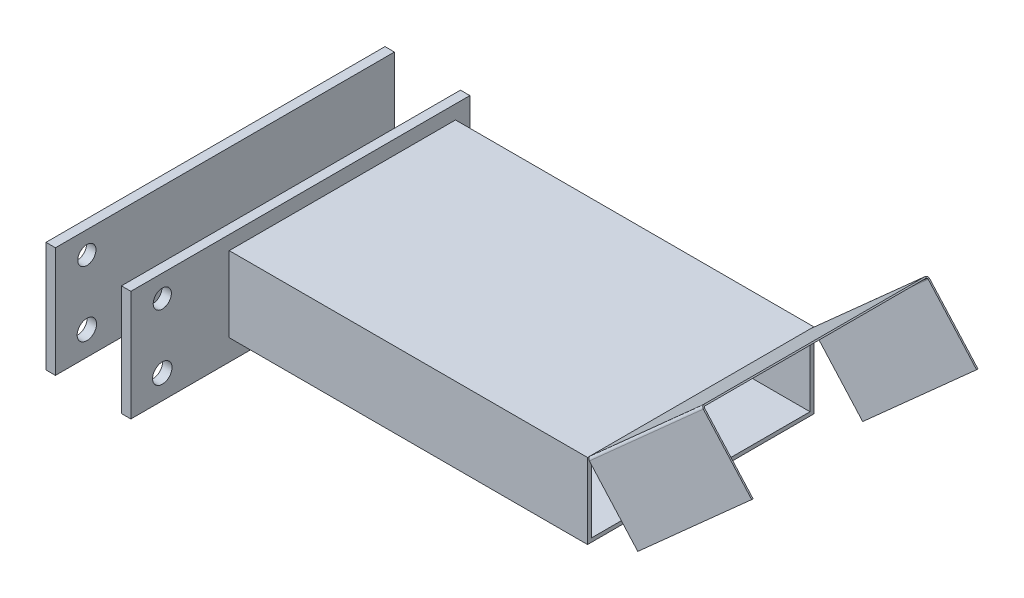
from build123d import *

# Parameters (mm, degrees)
SKETCH1_W                    = 120
SKETCH1_H                    = 40
SKETCH1_W_2                  = 116
SKETCH1_H_2                  = 36
BOSS_EXTRUDE1_DEPTH          = 190
SKETCH2_W                    = 179.779443165
SKETCH2_H                    = 58.646912064
SKETCH2_R                    = 4.82149765
SKETCH2_R_2                  = 5.140640696
BOSS_EXTRUDE2_DEPTH          = 5
BOSS_EXTRUDE3_START          = 40
SKETCH2_2_W                  = 179.779443165
SKETCH2_2_H                  = 58.646912064
SKETCH2_2_R                  = 4.82149765
SKETCH2_2_R_2                = 5.140640696
BOSS_EXTRUDE3_DEPTH          = 5
BASE_FLANGE1_DEPTH           = 120
EDGE_FLANGE1_STRIP_W         = 4.4196
EDGE_FLANGE1_STRIP_H         = 0.7366
EDGE_FLANGE1_STRIP_CUT_DEPTH = 81.034210559
EDGE_FLANGE1_DEPTH           = 81.034210559
EDGE_FLANGE2_STRIP_W         = 4.4196
EDGE_FLANGE2_STRIP_H         = 0.7366
EDGE_FLANGE2_STRIP_CUT_DEPTH = 81.034210559
EDGE_FLANGE2_DEPTH           = 81.034210559


# Sheet-metal steps are written as plain solids
with BuildPart() as part:
    # Sketch1 → Boss-Extrude1 (new body)
    with BuildSketch(Plane(origin=(0, 0, 0), x_dir=(0, 0, -1), z_dir=(1, 0, 0))):
        with Locations((60, -20)):
            Rectangle(SKETCH1_W, SKETCH1_H)
        with Locations((60, -20)):
            Rectangle(SKETCH1_W_2, SKETCH1_H_2, mode=Mode.SUBTRACT)
    extrude(amount=BOSS_EXTRUDE1_DEPTH)

    # Sketch2 → Boss-Extrude2 (add)
    with BuildSketch(Plane.ZY):
        with Locations((-37.714173415, -21.919353486)):
            Rectangle(SKETCH2_W, SKETCH2_H)
        with Locations((35.504640434, -4.261786117)):
            Circle(SKETCH2_R, mode=Mode.SUBTRACT)
        with Locations((35.504640434, -38.467545112)):
            Circle(SKETCH2_R_2, mode=Mode.SUBTRACT)
    extrude(amount=BOSS_EXTRUDE2_DEPTH)


with BuildPart() as body_2:
    # Sketch2<2> → Boss-Extrude3 (new body)
    with BuildSketch(Plane.ZY.offset(BOSS_EXTRUDE3_START)):
        with Locations((-37.714173415, -21.919353486)):
            Rectangle(SKETCH2_2_W, SKETCH2_2_H)
        with Locations((35.504640434, -4.261786117)):
            Circle(SKETCH2_2_R, mode=Mode.SUBTRACT)
        with Locations((35.504640434, -38.467545112)):
            Circle(SKETCH2_2_R_2, mode=Mode.SUBTRACT)
    extrude(amount=BOSS_EXTRUDE3_DEPTH)


with BuildPart() as body_3:
    # Sketch4 → Base-Flange1 (new body)
    with BuildSketch(Plane.XY):
        Polygon((190, 0), (250.413405054, 54.007071488), (250.904328684, 53.457914362), (190.490923631, -0.549157126), align=None)
    extrude(amount=-BASE_FLANGE1_DEPTH)

    # Edge-Flange1 strip (across the edge) → Edge-Flange1 strip cut (cut)
    with BuildSketch(Plane(origin=(250.904328684, 53.457914362, 0), x_dir=(0, 0, -1), z_dir=(-0.745529630475018, -0.6664724826155866, 0))):
        with Locations((-0.7366, -0.3683)):
            Rectangle(EDGE_FLANGE1_STRIP_W, EDGE_FLANGE1_STRIP_H)
    extrude(amount=EDGE_FLANGE1_STRIP_CUT_DEPTH, mode=Mode.SUBTRACT)

    # Edge-Flange1 section (across the edge) → Edge-Flange1 (add)
    with BuildSketch(Plane(origin=(250.904328684, 53.457914362, 0), x_dir=(0, 0, -1), z_dir=(-0.745529630475018, -0.6664724826155866, 0))):
        with BuildLine():
            Line((0, 0.7366), (0, 39.2634))
            Line((0, 39.2634), (0.7366, 39.2634))
            Line((0.7366, 39.2634), (0.7366, 0.7366))
            ThreePointArc((0.7366, 0.7366), (0.952345145, 0.215745145), (1.4732, 0))
            Line((1.4732, 0), (1.4732, -0.7366))
            ThreePointArc((1.4732, -0.7366), (0.43149029, -0.30510971), (0, 0.7366))
        make_face()
    extrude(amount=EDGE_FLANGE1_DEPTH)

    # Edge-Flange2 strip (across the edge) → Edge-Flange2 strip cut (cut)
    with BuildSketch(Plane(origin=(190.490923631, -0.549157126, -120), x_dir=(0, 0, 1), z_dir=(0.745529630475018, 0.6664724826155866, 0))):
        with Locations((-0.7366, -0.3683)):
            Rectangle(EDGE_FLANGE2_STRIP_W, EDGE_FLANGE2_STRIP_H)
    extrude(amount=EDGE_FLANGE2_STRIP_CUT_DEPTH, mode=Mode.SUBTRACT)

    # Edge-Flange2 section (across the edge) → Edge-Flange2 (add)
    with BuildSketch(Plane(origin=(190.490923631, -0.549157126, -120), x_dir=(0, 0, 1), z_dir=(0.745529630475018, 0.6664724826155866, 0))):
        with BuildLine():
            Line((0, 0.7366), (0, 39.2634))
            Line((0, 39.2634), (0.7366, 39.2634))
            Line((0.7366, 39.2634), (0.7366, 0.7366))
            ThreePointArc((0.7366, 0.7366), (0.952345145, 0.215745145), (1.4732, 0))
            Line((1.4732, 0), (1.4732, -0.7366))
            ThreePointArc((1.4732, -0.7366), (0.43149029, -0.30510971), (0, 0.7366))
        make_face()
    extrude(amount=EDGE_FLANGE2_DEPTH)


solid = Compound([part.part, body_2.part, body_3.part])
